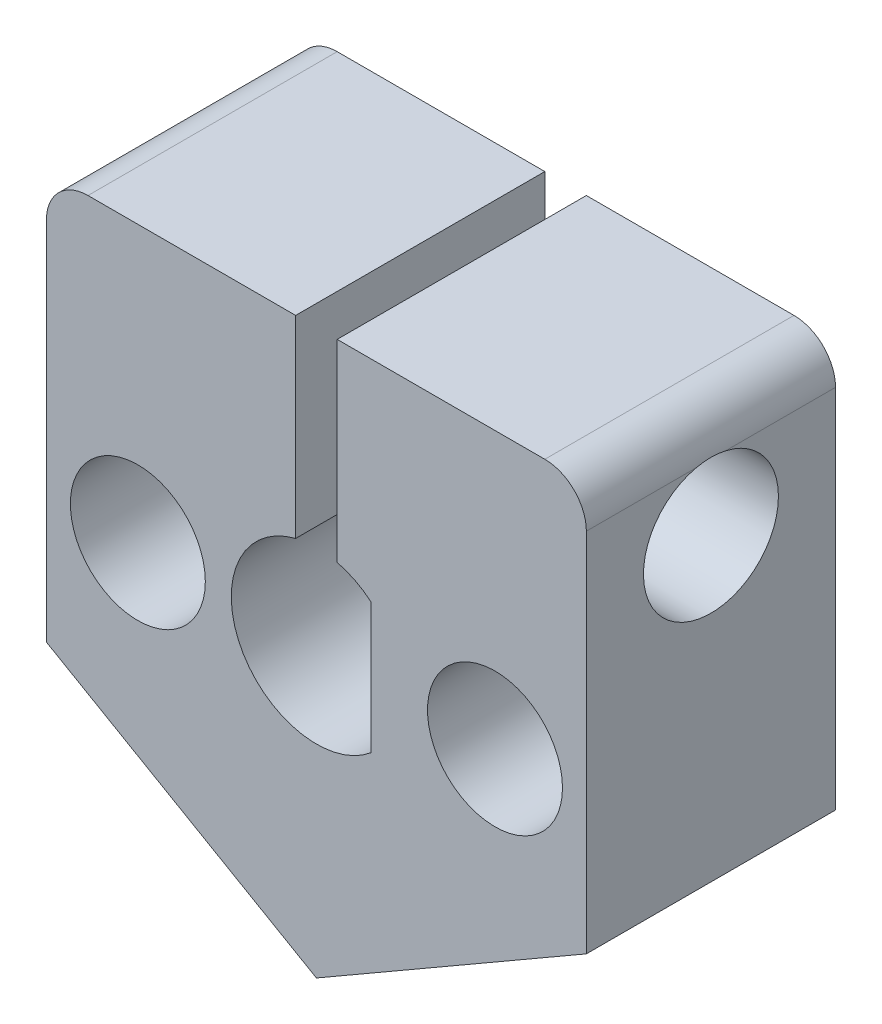
from build123d import *

# Parameters (mm, degrees)
BOSS_EXTRUDE1_DEPTH            = 12
SKETCH41_R                     = 1.7
CUT_EXTRUDE7_DEPTH             = 18
CBORE_FOR_M3_SHCS1_D           = 3.4
CBORE_FOR_M3_SHCS1_CBORE_D     = 6.5
CBORE_FOR_M3_SHCS1_CBORE_DEPTH = 3
F_3DSKETCH3_START              = 9
F_3DSKETCH3_OUTLINE_R          = 3.25
F_3DSKETCH3_OUTLINE_R_2        = 1.7
F_3DSKETCH3_DEPTH              = 3
CUT_EXTRUDE10_DEPTH            = 15
CUT_EXTRUDE10_DEPTH_BACK       = 15
SKETCH52_R                     = 1.7
SKETCH58_R                     = 3.25
CUT_EXTRUDE11_DEPTH            = 8
CUT_EXTRUDE12_DEPTH            = 4
CUT_EXTRUDE12_DEPTH_BACK       = 6
FILLET1_R                      = 2
SKETCH61_R                     = 3.25
CUT_EXTRUDE13_DEPTH            = 6
CUT_EXTRUDE14_DEPTH            = 1


# Read off the part's stored shape, not the designer's step: 3DSketch3
with BuildPart() as part:
    # Sketch1 → Boss-Extrude1 (new body)
    with BuildSketch(Plane(origin=(0, 0, 0), x_dir=(0, 1, 0), z_dir=(0, 0, 1))):
        with BuildLine():
            Line((-6.350852961, -13), (13.279056191, -13))
            Line((13.279056191, -13), (13.279056191, -1))
            Line((13.279056191, -1), (3.97617907, -1))
            ThreePointArc((3.97617907, -1), (3.650947901, -1.865631106), (3.14, -2.636361129))
            Line((3.14, -2.636361129), (-3.14, -2.636361129))
            ThreePointArc((-3.14, -2.636361129), (-3.852531635, -1.402854233), (-4.1, 0))
            ThreePointArc((-4.1, 0), (-0.503818326, 4.06892702), (3.97617907, 1))
            Line((3.97617907, 1), (13.279056191, 1))
            Line((13.279056191, 1), (13.279056191, 13))
            Line((13.279056191, 13), (-6.350852961, 13))
            Line((-6.350852961, 13), (-13.856406461, 0))
            Line((-13.856406461, 0), (-6.350852961, -13))
        make_face()
    extrude(amount=BOSS_EXTRUDE1_DEPTH)

    # Sketch41 → Cut-Extrude7 (cut)
    with BuildSketch(Plane(origin=(0, 0, 0), x_dir=(0, 1, 0), z_dir=(0, 0, 1))):
        with Locations(Location((0, 8.6, 0), (0, 0, 270))):
            Circle(SKETCH41_R)
        with Locations(Location((0, -8.6, 0), (0, 0, 270))):
            Circle(SKETCH41_R)
    extrude(amount=CUT_EXTRUDE7_DEPTH, mode=Mode.SUBTRACT)

    # CBORE for M3 SHCS1 (through all)
    with Locations(Plane(origin=(-8.6, 0, 12), x_dir=(1, 0, 0), z_dir=(0, 0, 1))):
        with Locations((0, 0)):
            CounterBoreHole(CBORE_FOR_M3_SHCS1_D / 2, CBORE_FOR_M3_SHCS1_CBORE_D / 2, CBORE_FOR_M3_SHCS1_CBORE_DEPTH)

    # 3DSketch3 outline → 3DSketch3 (cut)
    with BuildSketch(Plane.XY.offset(F_3DSKETCH3_START)):
        with Locations((8.6, 0)):
            Circle(F_3DSKETCH3_OUTLINE_R)
        with Locations((8.6, 0)):
            Circle(F_3DSKETCH3_OUTLINE_R_2, mode=Mode.SUBTRACT)
    extrude(amount=F_3DSKETCH3_DEPTH, mode=Mode.SUBTRACT)

    # Sketch52 → Cut-Extrude10 (cut, two sides: drawn at the far end of the back side and taken through both)
    with BuildSketch(Plane.YZ.offset(-1).offset(-CUT_EXTRUDE10_DEPTH_BACK)):
        with Locations((8.106406461, 6)):
            Circle(SKETCH52_R)
    extrude(amount=CUT_EXTRUDE10_DEPTH + CUT_EXTRUDE10_DEPTH_BACK, mode=Mode.SUBTRACT)

    # Sketch58 → Cut-Extrude11 (cut)
    with BuildSketch(Plane.YZ.offset(13)):
        with Locations(Location((8.106406461, 6, 0), (0, 0, 270))):
            Circle(SKETCH58_R)
    extrude(amount=-CUT_EXTRUDE11_DEPTH, mode=Mode.SUBTRACT)

    # Sketch60 → Cut-Extrude12 (cut, two sides: drawn at the far end of the back side and taken through both)
    with BuildSketch(Plane.YZ.offset(-8).offset(-CUT_EXTRUDE12_DEPTH_BACK)):
        Polygon((8.106406461, 2.709103466), (10.956406461, 4.354551733), (10.956406461, 7.645448267), (8.106406461, 9.290896534), (5.256406461, 7.645448267), (5.256406461, 4.354551733), align=None)
    extrude(amount=CUT_EXTRUDE12_DEPTH + CUT_EXTRUDE12_DEPTH_BACK, mode=Mode.SUBTRACT)

    # Fillet1
    # the kernel refuses this fillet: 2 mm, written as the material it takes off along each edge
    with BuildSketch(Plane(origin=(13, 13.279056191, -5), x_dir=(0, -1, 0), z_dir=(0, 0, 1)), Plane(origin=(-13, 13.279056191, -5), x_dir=(1, 0, 0), z_dir=(0, 0, 1))) as fillet1_piece_1:
        with BuildLine():
            CenterArc((FILLET1_R, -FILLET1_R), FILLET1_R, 90, 90)
            Line((0, -FILLET1_R), (0, 0))
            Line((0, 0), (FILLET1_R, 0))
        make_face()
    extrude(amount=22, mode=Mode.SUBTRACT)

    # Sketch61 → Cut-Extrude13 (cut)
    with BuildSketch(Plane(origin=(0, 0, 12), x_dir=(0, 1, 0), z_dir=(0, 0, 1))):
        with Locations(Location((0, 8.6, 0), (0, 0, 270))):
            Circle(SKETCH61_R)
        with Locations(Location((0, -8.6, 0), (0, 0, 270))):
            Circle(SKETCH61_R)
    extrude(amount=-CUT_EXTRUDE13_DEPTH, mode=Mode.SUBTRACT)

    # Sketch62 → Cut-Extrude14 (cut)
    with BuildSketch(Plane(origin=(-6, -10.392304845, 0), x_dir=(-0.8660254037844386, 0.5000000000000001, 0), z_dir=(-0.5000000000000001, -0.8660254037844386, 0))):
        with BuildLine():
            Line((1.32365953, -3.245174166), (1.009556966, -3.245174166))
            add(Edge.make_bspline(
                [(1.009556966, -3.245174166), (1.011604119, -3.203503278), (1.015624673, -3.121662763), (1.034452962, -3.002338857), (1.061393839, -2.888284058), (1.099485293, -2.780414144), (1.146791571, -2.677775337), (1.203521598, -2.580775321), (1.270715449, -2.489784132), (1.346922183, -2.405645289), (1.429690822, -2.328457718), (1.518996761, -2.261802476), (1.612841789, -2.205484804), (1.710941188, -2.158403562), (1.814401751, -2.123063716), (1.922284609, -2.096842077), (2.035063745, -2.081065731), (2.111903767, -2.079369946), (2.150983248, -2.078507499)],
                knots=[0, 0, 0, 0, 1.10065271, 2.161652631, 3.183658789, 4.190468796, 5.17591951, 6.163126047, 7.15150782, 8.156236427, 9.156009102, 10.134482811, 11.092018607, 12.041330605, 13.001268258, 13.972401359, 14.968799086, 16, 16, 16, 16], degree=3))
            add(Edge.make_bspline(
                [(2.150983248, -2.078507499), (2.189361322, -2.079405955), (2.264772866, -2.08117139), (2.374834881, -2.096332419), (2.479612175, -2.120078011), (2.578899942, -2.153393427), (2.671906006, -2.198177855), (2.759329051, -2.251975393), (2.842209862, -2.314195225), (2.916816645, -2.387449038), (2.985324725, -2.465651423), (3.04442698, -2.549139326), (3.095040143, -2.635368612), (3.137227823, -2.724996814), (3.168283962, -2.818867842), (3.19186217, -2.915615045), (3.205189584, -3.016239856), (3.207235007, -3.084346411), (3.208274914, -3.118972242)],
                knots=[0, 0, 0, 0, 1.111607364, 2.184268762, 3.212621178, 4.221274766, 5.211760367, 6.196651075, 7.1921475, 8.207485113, 9.220403448, 10.201281604, 11.166441695, 12.114753415, 13.065576456, 14.026450734, 14.996634279, 16, 16, 16, 16], degree=3))
            add(Edge.make_bspline(
                [(3.208274914, -3.118972242), (3.206588269, -3.167722052), (3.203244578, -3.26436618), (3.174388875, -3.406570537), (3.129806778, -3.544475597), (3.075733749, -3.655454649), (3.021113181, -3.744431542), (2.972933386, -3.818347183), (2.915281033, -3.8971736), (2.84868362, -3.981704709), (2.774145813, -4.072199079), (2.691131146, -4.168693845), (2.599005455, -4.27016415), (2.534347273, -4.339469963), (2.500843023, -4.375382499)],
                knots=[0, 0, 0, 0, 1.184203166, 2.347625244, 3.513805382, 4.700623107, 5.337941753, 6.051866363, 6.845199593, 7.711357327, 8.668078039, 9.695487809, 10.805859518, 12, 12, 12, 12], degree=3))
            Line((2.500843023, -4.375382499), (1.625141902, -5.30927673))
            Line((1.625141902, -5.30927673), (3.253146709, -5.30927673))
            Line((3.253146709, -5.30927673), (3.253146709, -5.668251089))
            Line((3.253146709, -5.668251089), (0.874941581, -5.668251089))
            Line((0.874941581, -5.668251089), (2.232313376, -4.21973346))
            add(Edge.make_bspline(
                [(2.232313376, -4.21973346), (2.265361263, -4.185235154), (2.32883949, -4.118970967), (2.418622067, -4.022228007), (2.499261055, -3.932478466), (2.571278448, -3.849891918), (2.633111953, -3.77326035), (2.687984185, -3.705065647), (2.731949776, -3.642311196), (2.779665172, -3.569570582), (2.825879153, -3.480758265), (2.865591509, -3.372224576), (2.889806358, -3.260497323), (2.892711193, -3.184995286), (2.89417235, -3.147017114)],
                knots=[0, 0, 0, 0, 1.329631726, 2.553950428, 3.673215718, 4.687767853, 5.603093632, 6.413772471, 7.123043292, 7.734684054, 8.834405432, 9.900288307, 10.943827018, 12, 12, 12, 12], degree=3))
            add(Edge.make_bspline(
                [(2.89417235, -3.147017114), (2.893536608, -3.123135716), (2.892283682, -3.076070065), (2.881225984, -3.007064306), (2.864515478, -2.940499493), (2.84057022, -2.876170874), (2.80896348, -2.814725221), (2.7704901, -2.756087741), (2.726100037, -2.699398776), (2.674748768, -2.646245478), (2.618337248, -2.597564273), (2.558742998, -2.554440187), (2.495692894, -2.518401076), (2.429452772, -2.488857579), (2.360207302, -2.465682198), (2.287822557, -2.449623619), (2.212498541, -2.439541135), (2.161065045, -2.438176963), (2.134857446, -2.437481858)],
                knots=[0, 0, 0, 0, 0.991446411, 1.95395049, 2.89581595, 3.838931463, 4.798493298, 5.75982156, 6.748411868, 7.785213223, 8.824556874, 9.840280684, 10.836137867, 11.835679398, 12.848801643, 13.863922112, 14.911575587, 16, 16, 16, 16], degree=3))
            add(Edge.make_bspline(
                [(2.134857446, -2.437481858), (2.107486614, -2.43819689), (2.053734817, -2.439601095), (1.974815784, -2.449423759), (1.899530007, -2.4663696), (1.827688104, -2.489546274), (1.759168518, -2.519004823), (1.694304474, -2.555696568), (1.633241585, -2.599480061), (1.575865062, -2.649120617), (1.523001082, -2.704388218), (1.476554207, -2.765998181), (1.435970192, -2.832825597), (1.400560959, -2.904690147), (1.371805269, -2.982243927), (1.349832118, -3.065211632), (1.332445272, -3.153233014), (1.326636751, -3.214018099), (1.32365953, -3.245174166)],
                knots=[0, 0, 0, 0, 1.031018746, 2.02475058, 2.990194455, 3.934040569, 4.864654155, 5.795059489, 6.735614925, 7.690564532, 8.649604399, 9.611025574, 10.590972636, 11.591080095, 12.624614302, 13.701020113, 14.821632451, 16, 16, 16, 16], degree=3))
        make_face()
    extrude(amount=-CUT_EXTRUDE14_DEPTH, mode=Mode.SUBTRACT)


solid = part.part
